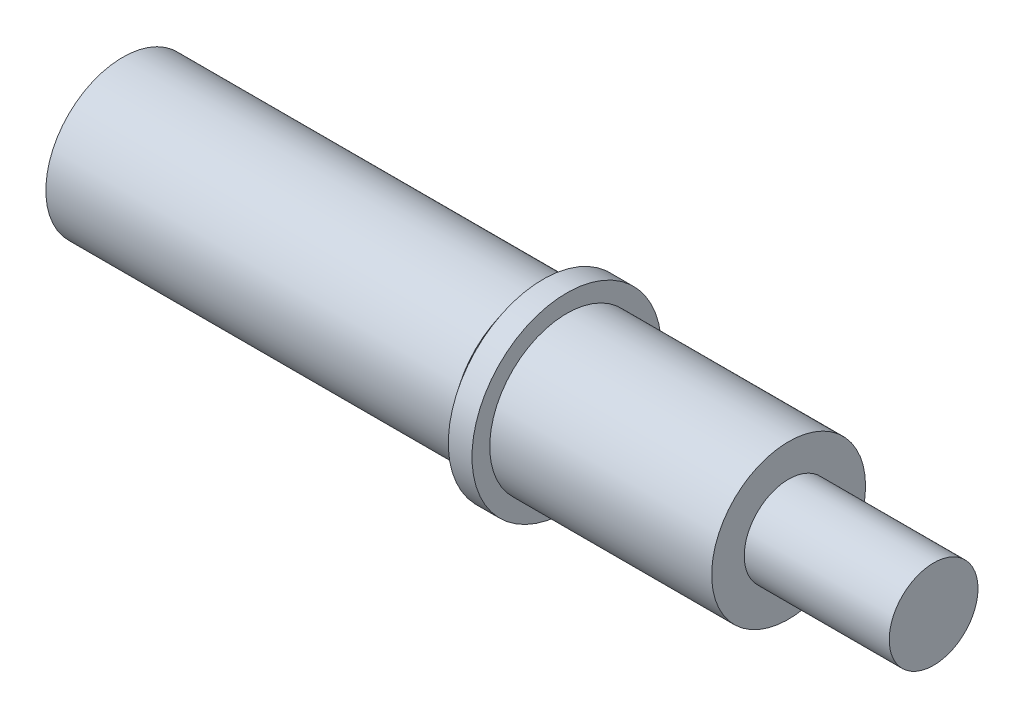
from build123d import *

# Parameters (mm, degrees)
SKETCH1_R                                = 26
BOSS_EXTRUDE1_DEPTH                      = 137.5
SKETCH2_R                                = 22
BOSS_EXTRUDE2_DEPTH                      = 4.5
SKETCH3_R                                = 32
BOSS_EXTRUDE3_DEPTH                      = 8
SKETCH4_R                                = 26
BOSS_EXTRUDE4_DEPTH                      = 75
F_12_0_12_DIAMETER_HOLE1_D               = 12
F_12_0_12_DIAMETER_HOLE1_DEPTH           = 20
F_12_0_12_DIAMETER_HOLE1_TIP             = 3.605163714
F_12_0_12_DIAMETER_HOLE1_ON_FACE_2_D     = 12
F_12_0_12_DIAMETER_HOLE1_ON_FACE_2_DEPTH = 20
F_12_0_12_DIAMETER_HOLE1_ON_FACE_2_TIP   = 3.605163714
SKETCH6_R                                = 15
BOSS_EXTRUDE5_DEPTH                      = 49


with BuildPart() as part:
    # Sketch1 → Boss-Extrude1 (new body)
    with BuildSketch(Plane(origin=(0, 0, 0), x_dir=(0, 0, -1), z_dir=(1, 0, 0))):
        Circle(SKETCH1_R)
    extrude(amount=BOSS_EXTRUDE1_DEPTH)

    # Sketch2 → Boss-Extrude2 (add)
    with BuildSketch(Plane(origin=(137.5, 0, 0), x_dir=(0, 0, -1), z_dir=(1, 0, 0))):
        Circle(SKETCH2_R)
    extrude(amount=BOSS_EXTRUDE2_DEPTH)

    # Sketch3 → Boss-Extrude3 (add)
    with BuildSketch(Plane(origin=(142, 0, 0), x_dir=(0, 0, -1), z_dir=(1, 0, 0))):
        Circle(SKETCH3_R)
    extrude(amount=BOSS_EXTRUDE3_DEPTH)

    # Sketch4 → Boss-Extrude4 (add)
    with BuildSketch(Plane(origin=(150, 0, 0), x_dir=(0, 0, -1), z_dir=(1, 0, 0))):
        Circle(SKETCH4_R)
    extrude(amount=BOSS_EXTRUDE4_DEPTH)

    # Ø12.0 (12) Diameter Hole1
    with Locations(Plane(origin=(0, 0, 0), x_dir=(0, 0, -1), z_dir=(-1, 0, 0))):
        with Locations((0, 0)):
            Hole(F_12_0_12_DIAMETER_HOLE1_D / 2, depth=F_12_0_12_DIAMETER_HOLE1_DEPTH)
            with Locations((0, 0, -(F_12_0_12_DIAMETER_HOLE1_DEPTH + F_12_0_12_DIAMETER_HOLE1_TIP / 2))):  # 118° drill point
                Cone(0, F_12_0_12_DIAMETER_HOLE1_D / 2, F_12_0_12_DIAMETER_HOLE1_TIP, mode=Mode.SUBTRACT)

    # Ø12.0 (12) Diameter Hole1 on face 2
    with Locations(Plane(origin=(-153.563701333, 12.350945858, 0), x_dir=(0, 0, -1), z_dir=(-1, 0, 0))):
        with Locations((0, 0)):
            Hole(F_12_0_12_DIAMETER_HOLE1_ON_FACE_2_D / 2, depth=F_12_0_12_DIAMETER_HOLE1_ON_FACE_2_DEPTH)
            with Locations((0, 0, -(F_12_0_12_DIAMETER_HOLE1_ON_FACE_2_DEPTH + F_12_0_12_DIAMETER_HOLE1_ON_FACE_2_TIP / 2))):  # 118° drill point
                Cone(0, F_12_0_12_DIAMETER_HOLE1_ON_FACE_2_D / 2, F_12_0_12_DIAMETER_HOLE1_ON_FACE_2_TIP, mode=Mode.SUBTRACT)

    # Sketch6 → Boss-Extrude5 (add)
    with BuildSketch(Plane(origin=(225, 0, 0), x_dir=(0, 0, -1), z_dir=(1, 0, 0))):
        Circle(SKETCH6_R)
    extrude(amount=BOSS_EXTRUDE5_DEPTH)


solid = part.part
